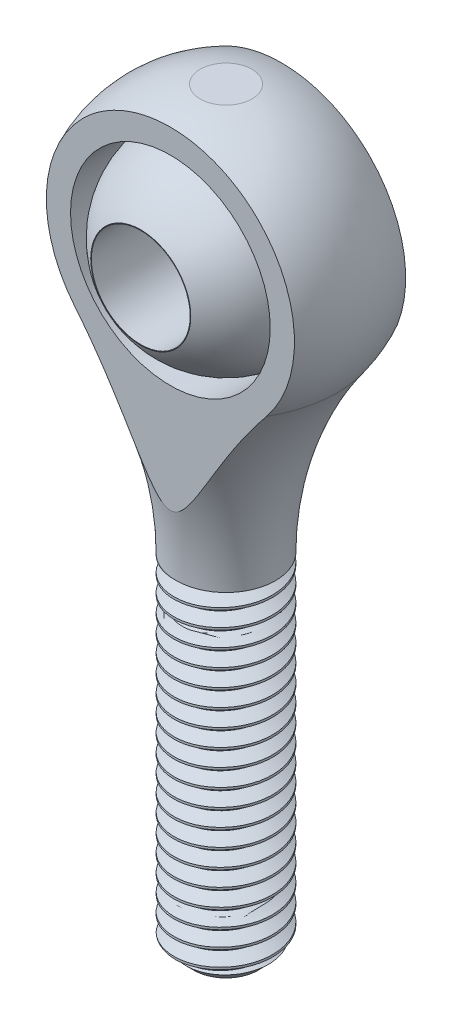
from build123d import *

# Parameters (mm, degrees)
SKETCH1_W               = 2
SKETCH1_H               = 14
CHAMFER2_SIZE           = 0.7
CUT_SWEEP1_PITCH        = 0.7
CUT_EXTRUDE1_DEPTH      = 19.241436347
CUT_EXTRUDE1_DEPTH_BACK = 19.241436347
CUT_EXTRUDE2_DEPTH      = 18.53745992
CUT_EXTRUDE2_DEPTH_BACK = 18.53745992
SKETCH6_R               = 4.04
CUT_EXTRUDE3_DEPTH      = 18.846568298
CUT_EXTRUDE3_DEPTH_BACK = 18.846568298
SKETCH8_W               = 2.05
SKETCH8_H               = 16.5
CUT_EXTRUDE4_DEPTH      = 18.846568298
CUT_EXTRUDE4_DEPTH_BACK = 18.846568298
SKETCH10_R              = 2
CUT_EXTRUDE5_DEPTH      = 18.846568298
CUT_EXTRUDE5_DEPTH_BACK = 18.846568298
SKETCH14_W              = 11
SKETCH14_H              = 0.1


with BuildPart() as part:
    # Sketch1 → Revolve1 (revolve)
    with BuildSketch(Plane.XY, mode=Mode.PRIVATE) as revolve1_sk:
        with Locations((1, -7)):
            Rectangle(SKETCH1_W, SKETCH1_H)
    revolve(revolve1_sk.sketch.rotate(Axis((0, 16.5, 0), (0, -1, 0)), 180), axis=Axis((0, 16.5, 0), (0, -1, 0)))

    # Chamfer2
    chamfer2_edges = [part.edges().sort_by_distance(p)[0] for p in [
        (2, -14, 0),
    ]]
    chamfer(chamfer2_edges, length=CHAMFER2_SIZE)

    # Cut-Sweep1: the profile of Sketch13 profile screwed along a right-hand helix of 21 turns, 6 arcs to a turn; built about Z, then put on its axis
    cut_sweep1_z = Axis((0, 0, 0), (0, 0, 1))
    cut_sweep1_corners = [(2.0003, 0, -0.612673205), (2.0003, 0, 0.000173205), (1.545336663, 0, -0.2625), (1.545336663, 0, -0.35)]
    with BuildLine(mode=Mode.PRIVATE) as cut_sweep1_profile:
        Line(cut_sweep1_corners[0], cut_sweep1_corners[1])
        Line(cut_sweep1_corners[1], cut_sweep1_corners[2])
        Line(cut_sweep1_corners[2], cut_sweep1_corners[3])
        Line(cut_sweep1_corners[3], cut_sweep1_corners[0])
    cut_sweep1_cap = Face(cut_sweep1_profile.wire())
    cut_sweep1_turn_angles = [0, 30, 60, 90, 120, 150, 180, 210, 240, 270, 300, 330, 360]
    cut_sweep1_turn_weights = [1, 0.8660254037844387, 1, 0.8660254037844387, 1, 0.8660254037844387, 1, 0.8660254037844387, 1, 0.8660254037844387, 1, 0.8660254037844387, 1]
    cut_sweep1_turn_rails = [Edge.make_bspline([Vector(p[0], p[1], 0).rotate(cut_sweep1_z, cut_sweep1_turn_angles[k]) / cut_sweep1_turn_weights[k] + Vector(0, 0, p[2] + CUT_SWEEP1_PITCH * cut_sweep1_turn_angles[k] / 360) for k in range(13)], [0, 0, 0, 1, 1, 2, 2, 3, 3, 4, 4, 5, 5, 6, 6, 6], 2, cut_sweep1_turn_weights) for p in cut_sweep1_corners]
    cut_sweep1_turn_sides = [Face.make_surface_from_curves(cut_sweep1_turn_rails[p[0]], cut_sweep1_turn_rails[p[1]]) for p in [(0, 1), (1, 2), (2, 3), (3, 0)]]
    cut_sweep1 = Plane(origin=(0, -14, 0), x_dir=(0, 0, 1), z_dir=(0, 1, 0)) * Solid(Shell([*[p.moved(Location((0, 0, CUT_SWEEP1_PITCH * i))) for i in range(21) for p in cut_sweep1_turn_sides], cut_sweep1_cap, cut_sweep1_cap.rotate(cut_sweep1_z, 7560).moved(Location((0, 0, CUT_SWEEP1_PITCH * 7560 / 360)))]))
    add(cut_sweep1, mode=Mode.SUBTRACT)

    # Sketch4 → Revolve2 (revolve)
    with BuildSketch(Plane.XY, mode=Mode.PRIVATE) as revolve2_sk:
        with BuildLine():
            Line((2, 0), (0, 0))
            Line((0, 0), (0, 16.5))
            ThreePointArc((0, 16.5), (4.885197037, 13.526826054), (4.488742964, 7.821763602))
            ThreePointArc((4.488742964, 7.821763602), (2.637183192, 4.104078075), (2, 0))
        make_face()
    revolve(revolve2_sk.sketch.rotate(Axis((0, 16.5, 0), (0, 1, 0)), 180), axis=Axis((0, 16.5, 0), (0, 1, 0)))

    # Sketch5 → Cut-Extrude1 (cut, two sides: drawn at the far end of the back side and taken through both)
    with BuildSketch(Plane(origin=(0, 0, 0), x_dir=(0, 0, -1), z_dir=(1, 0, 0)).offset(-CUT_EXTRUDE1_DEPTH_BACK)):
        Polygon((2.25, 16.5), (5.5, 16.5), (5.5, 0), (2, 0), (2.25, 0.9), align=None)
        Polygon((-2.25, 16.5), (-2.25, 0.9), (-2, 0), (-5.5, 0), (-5.5, 16.5), align=None)
    extrude(amount=CUT_EXTRUDE1_DEPTH + CUT_EXTRUDE1_DEPTH_BACK, mode=Mode.SUBTRACT)

    # Sketch6 → Cut-Extrude2 (cut, two sides: drawn at the far end of the back side and taken through both)
    with BuildSketch(Plane.XY.offset(-CUT_EXTRUDE2_DEPTH_BACK)):
        with Locations((0, 11)):
            Circle(SKETCH6_R)
    extrude(amount=CUT_EXTRUDE2_DEPTH + CUT_EXTRUDE2_DEPTH_BACK, mode=Mode.SUBTRACT)

    # Sketch14 → Cut-Extrude5 (cut, two sides: drawn at the far end of the back side and taken through both)
    with BuildSketch(Plane.XY.offset(-CUT_EXTRUDE5_DEPTH_BACK)):
        with Locations((0, 16.45)):
            Rectangle(SKETCH14_W, SKETCH14_H)
    extrude(amount=CUT_EXTRUDE5_DEPTH + CUT_EXTRUDE5_DEPTH_BACK, mode=Mode.SUBTRACT)


with BuildPart() as body_2:
    # Sketch7 → Revolve3 (revolve)
    with BuildSketch(Plane.XY):
        with BuildLine():
            Line((0, 15), (0, 7))
            ThreePointArc((0, 7), (4, 11), (0, 15))
        make_face()
    revolve(axis=Axis((0, 0, 0), (0, 1, 0)))

    # Sketch8 → Cut-Extrude3 (cut, two sides: drawn at the far end of the back side and taken through both)
    with BuildSketch(Plane(origin=(0, 0, 0), x_dir=(0, 0, -1), z_dir=(1, 0, 0)).offset(-CUT_EXTRUDE3_DEPTH_BACK)):
        with Locations((-4.475, 8.25)):
            Rectangle(SKETCH8_W, SKETCH8_H)
        with Locations((4.475, 8.25)):
            Rectangle(SKETCH8_W, SKETCH8_H)
    extrude(amount=CUT_EXTRUDE3_DEPTH + CUT_EXTRUDE3_DEPTH_BACK, mode=Mode.SUBTRACT)

    # Sketch10 → Cut-Extrude4 (cut, two sides: drawn at the far end of the back side and taken through both)
    with BuildSketch(Plane.XY.offset(-CUT_EXTRUDE4_DEPTH_BACK)):
        with Locations((0, 11)):
            Circle(SKETCH10_R)
    extrude(amount=CUT_EXTRUDE4_DEPTH + CUT_EXTRUDE4_DEPTH_BACK, mode=Mode.SUBTRACT)


solid = Compound([part.part, body_2.part])
